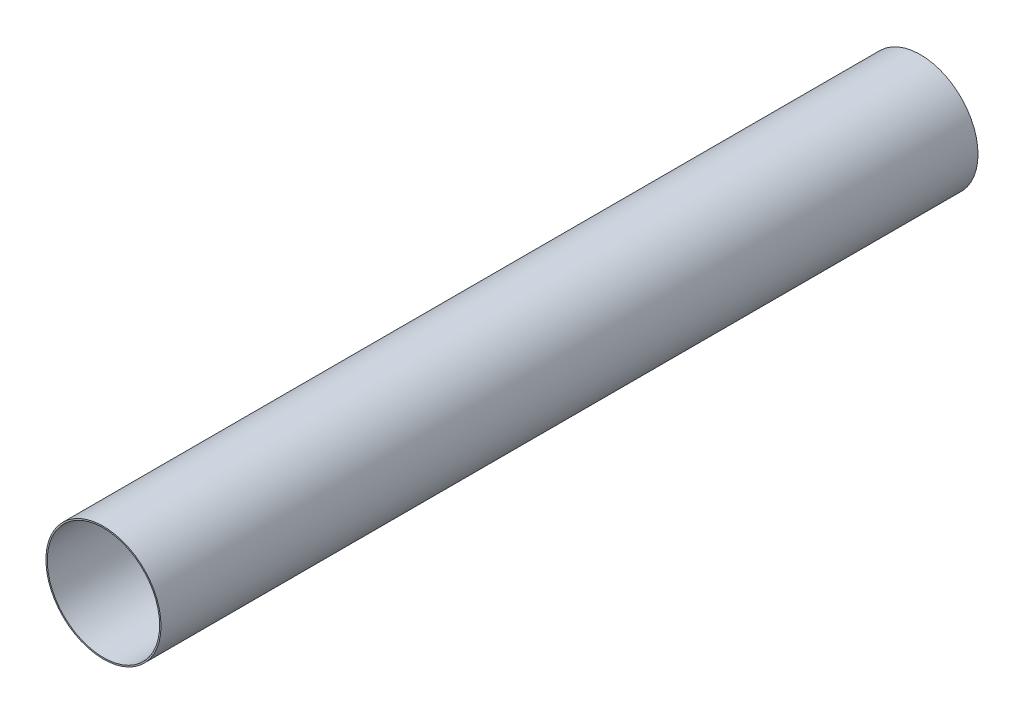
from build123d import *

# Parameters (mm, degrees)
SKETCH1_R           = 84.55
SKETCH1_R_2         = 82.55
BOSS_EXTRUDE1_DEPTH = 600


with BuildPart() as part:
    # Sketch1 → Boss-Extrude1 (new, symmetric)
    with BuildSketch(Plane.XY):
        Circle(SKETCH1_R)
        Circle(SKETCH1_R_2, mode=Mode.SUBTRACT)
    extrude(amount=BOSS_EXTRUDE1_DEPTH, both=True)


solid = part.part
